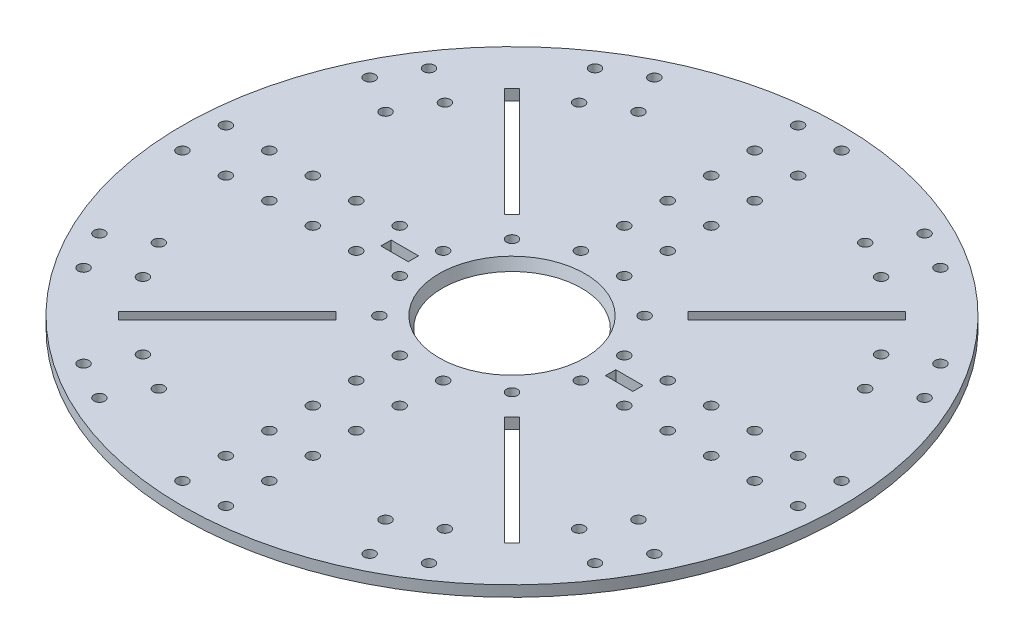
from build123d import *

# Parameters (mm, degrees)
BOSS_EXTRUDE2_DEPTH          = 3
CIRPATTERN2_COUNT            = 4
CUT_EXTRUDE3_DEPTH           = 6
CIRPATTERN4_COUNT            = 4
CUT_EXTRUDE4_START           = -33.9
SKETCH7_W                    = 6
SKETCH7_H                    = 6
CUT_EXTRUDE4_DEPTH           = 33.9
SKETCH8_R                    = 3.175
CUT_EXTRUDE5_DEPTH           = 276.405074148
CUT_EXTRUDE6_REACH           = 278.346
SKETCH11_R                   = 3.2
LPATTERN2_COUNT              = 2
LPATTERN2_PITCH              = 25.4
LPATTERN2_COUNT_DIR2         = 6
LPATTERN2_PITCH_DIR2         = 25.4
CIRPATTERN5_COUNT            = 4
CIRPATTERN5_COPY_1_REACH     = 278.346
CIRPATTERN5_COPY_1_SKETCH_R  = 3.2
CIRPATTERN5_COPY_2_REACH     = 278.346
CIRPATTERN5_COPY_2_SKETCH_R  = 3.2
CIRPATTERN5_COPY_3_REACH     = 278.346
CIRPATTERN5_COPY_3_SKETCH_R  = 3.2
CIRPATTERN5_COPY_4_REACH     = 278.346
CIRPATTERN5_COPY_4_SKETCH_R  = 3.2
CIRPATTERN5_COPY_5_REACH     = 278.346
CIRPATTERN5_COPY_5_SKETCH_R  = 3.2
CIRPATTERN5_COPY_6_REACH     = 278.346
CIRPATTERN5_COPY_6_SKETCH_R  = 3.2
CIRPATTERN5_COPY_7_REACH     = 278.346
CIRPATTERN5_COPY_7_SKETCH_R  = 3.2
CIRPATTERN5_COPY_8_REACH     = 278.346
CIRPATTERN5_COPY_8_SKETCH_R  = 3.2
CIRPATTERN5_COPY_9_REACH     = 278.346
CIRPATTERN5_COPY_9_SKETCH_R  = 3.2
CIRPATTERN5_COPY_10_REACH    = 278.346
CIRPATTERN5_COPY_10_SKETCH_R = 3.2
CIRPATTERN5_COPY_11_REACH    = 278.346
CIRPATTERN5_COPY_11_SKETCH_R = 3.2
CIRPATTERN5_COPY_12_REACH    = 278.346
CIRPATTERN5_COPY_12_SKETCH_R = 3.2
CIRPATTERN5_COPY_13_REACH    = 278.346
CIRPATTERN5_COPY_13_SKETCH_R = 3.2
CIRPATTERN5_COPY_14_REACH    = 278.346
CIRPATTERN5_COPY_14_SKETCH_R = 3.2
CIRPATTERN5_COPY_15_REACH    = 278.346
CIRPATTERN5_COPY_15_SKETCH_R = 3.2
CIRPATTERN5_COPY_16_REACH    = 278.346
CIRPATTERN5_COPY_16_SKETCH_R = 3.2
CIRPATTERN5_COPY_17_REACH    = 278.346
CIRPATTERN5_COPY_17_SKETCH_R = 3.2
CIRPATTERN5_COPY_18_REACH    = 278.346
CIRPATTERN5_COPY_18_SKETCH_R = 3.2
CIRPATTERN5_COPY_19_REACH    = 278.346
CIRPATTERN5_COPY_19_SKETCH_R = 3.2
CIRPATTERN5_COPY_20_REACH    = 278.346
CIRPATTERN5_COPY_20_SKETCH_R = 3.2
CIRPATTERN5_COPY_21_REACH    = 278.346
CIRPATTERN5_COPY_21_SKETCH_R = 3.2
CIRPATTERN5_COPY_22_REACH    = 278.346
CIRPATTERN5_COPY_22_SKETCH_R = 3.2
CIRPATTERN5_COPY_23_REACH    = 278.346
CIRPATTERN5_COPY_23_SKETCH_R = 3.2
CIRPATTERN5_COPY_24_REACH    = 278.346
CIRPATTERN5_COPY_24_SKETCH_R = 3.2
CIRPATTERN5_COPY_25_REACH    = 278.346
CIRPATTERN5_COPY_25_SKETCH_R = 3.2
CIRPATTERN5_COPY_26_REACH    = 278.346
CIRPATTERN5_COPY_26_SKETCH_R = 3.2
CIRPATTERN5_COPY_27_REACH    = 278.346
CIRPATTERN5_COPY_27_SKETCH_R = 3.2
CIRPATTERN5_COPY_28_REACH    = 278.346
CIRPATTERN5_COPY_28_SKETCH_R = 3.2
CIRPATTERN5_COPY_29_REACH    = 278.346
CIRPATTERN5_COPY_29_SKETCH_R = 3.2
CIRPATTERN5_COPY_30_REACH    = 278.346
CIRPATTERN5_COPY_30_SKETCH_R = 3.2
CIRPATTERN5_COPY_31_REACH    = 278.346
CIRPATTERN5_COPY_31_SKETCH_R = 3.2
CIRPATTERN5_COPY_32_REACH    = 278.346
CIRPATTERN5_COPY_32_SKETCH_R = 3.2
CIRPATTERN5_COPY_33_REACH    = 278.346
CIRPATTERN5_COPY_33_SKETCH_R = 3.2
SKETCH17_R                   = 3.2
CUT_EXTRUDE7_DEPTH           = 277.345716208
LPATTERN3_COUNT              = 2
LPATTERN3_PITCH              = 25.4
LPATTERN3_COUNT_DIR2         = 2
LPATTERN3_PITCH_DIR2         = 25.4
MIRROR1_COPY_1_SKETCH_R      = 3.2
MIRROR1_COPY_1_DEPTH         = 277.345716208
MIRROR1_COPY_2_SKETCH_R      = 3.2
MIRROR1_COPY_2_DEPTH         = 277.345716208
MIRROR1_COPY_3_SKETCH_R      = 3.2
MIRROR1_COPY_3_DEPTH         = 277.345716208
MIRROR2_COPY_1_SKETCH_R      = 3.2
MIRROR2_COPY_1_DEPTH         = 277.345716208
MIRROR2_COPY_2_SKETCH_R      = 3.2
MIRROR2_COPY_2_DEPTH         = 277.345716208
MIRROR2_COPY_3_SKETCH_R      = 3.2
MIRROR2_COPY_3_DEPTH         = 277.345716208
MIRROR2_COPY_4_SKETCH_R      = 3.2
MIRROR2_COPY_4_DEPTH         = 277.345716208
MIRROR2_COPY_5_SKETCH_R      = 3.2
MIRROR2_COPY_5_DEPTH         = 277.345716208
MIRROR2_COPY_6_SKETCH_R      = 3.2
MIRROR2_COPY_6_DEPTH         = 277.345716208
MIRROR2_COPY_7_SKETCH_R      = 3.2
MIRROR2_COPY_7_DEPTH         = 277.345716208
CUT_EXTRUDE8_REACH           = 278.346
CIRPATTERN6_COUNT            = 4
CUT_EXTRUDE13_REACH          = 278.346
SKETCH37_R                   = 3.2
CIRPATTERN11_COUNT           = 4
SKETCH23_R                   = 3.2
CUT_EXTRUDE9_DEPTH           = 5.602869
CIRPATTERN7_COUNT            = 2
CIRPATTERN7_ANGLE            = 30
CIRPATTERN8_COUNT            = 4
CIRPATTERN8_COPY_1_SKETCH_R  = 3.2
CIRPATTERN8_COPY_1_DEPTH     = 5.602869
CIRPATTERN8_COPY_2_SKETCH_R  = 3.2
CIRPATTERN8_COPY_2_DEPTH     = 5.602869
CIRPATTERN8_COPY_3_SKETCH_R  = 3.2
CIRPATTERN8_COPY_3_DEPTH     = 5.602869
SKETCH26_R                   = 3.2
CUT_EXTRUDE10_DEPTH          = 277.345716208
LPATTERN4_COUNT              = 2
LPATTERN4_PITCH              = 25.4
LPATTERN4_COUNT_DIR2         = 2
LPATTERN4_PITCH_DIR2         = 25.4
MIRROR3_COPY_1_SKETCH_R      = 3.2
MIRROR3_COPY_1_DEPTH         = 277.345716208
MIRROR3_COPY_2_SKETCH_R      = 3.2
MIRROR3_COPY_2_DEPTH         = 277.345716208
MIRROR3_COPY_3_SKETCH_R      = 3.2
MIRROR3_COPY_3_DEPTH         = 277.345716208
MIRROR4_COPY_1_SKETCH_R      = 3.2
MIRROR4_COPY_1_DEPTH         = 277.345716208
MIRROR4_COPY_2_SKETCH_R      = 3.2
MIRROR4_COPY_2_DEPTH         = 277.345716208
MIRROR4_COPY_3_SKETCH_R      = 3.2
MIRROR4_COPY_3_DEPTH         = 277.345716208
MIRROR4_COPY_4_SKETCH_R      = 3.2
MIRROR4_COPY_4_DEPTH         = 277.345716208
MIRROR4_COPY_5_SKETCH_R      = 3.2
MIRROR4_COPY_5_DEPTH         = 277.345716208
MIRROR4_COPY_6_SKETCH_R      = 3.2
MIRROR4_COPY_6_DEPTH         = 277.345716208
MIRROR4_COPY_7_SKETCH_R      = 3.2
MIRROR4_COPY_7_DEPTH         = 277.345716208
CUT_EXTRUDE11_REACH          = 278.346
SKETCH27_R                   = 3.2
CIRPATTERN9_COUNT            = 4
CUT_EXTRUDE12_REACH          = 280.445
SKETCH28_W                   = 56
SKETCH28_H                   = 6.4
CIRPATTERN10_COUNT           = 4
SPLIT2_START                 = -46.25
SPLIT2_OUTLINE_R             = 3.175
SPLIT2_OUTLINE_R_2           = 3.2
SPLIT2_DEPTH                 = 39.9
SPLIT2_START_2               = -6.35
SPLIT2_2_OUTLINE_W           = 16
SPLIT2_2_OUTLINE_H           = 6
SPLIT2_2_DEPTH               = 7.35


with BuildPart() as part:
    # Sketch1 → Revolve2 (revolve)
    with BuildSketch(Plane.XY, mode=Mode.PRIVATE) as revolve2_sk:
        Polygon((0, -40.25), (0, -46.25), (55.5, -46.25), (55.5, -40.64713119), (36.16453004, -40.64713119), (46.943459637, -6.35), (192.649801929, -6.35), (192.649801929, 0), (42.649801929, 0), (30, -40.25), align=None)
    revolve(revolve2_sk.sketch.rotate(Axis((0, -40.25, 0), (0, -1, 0)), 90), axis=Axis((0, -40.25, 0), (0, -1, 0)))

    # Sketch36 → Revolve3 (revolve)
    with BuildSketch(Plane.XY, mode=Mode.PRIVATE) as revolve3_sk:
        Polygon((46.943459637, -6.35), (45.057774878, -12.35), (66.943459637, -12.35), (66.943459637, -6.35), align=None)
    revolve(revolve3_sk.sketch.rotate(Axis((0, 0, 0), (0, -1, 0)), 180), axis=Axis((0, 0, 0), (0, -1, 0)))

    # Sketch3 → Boss-Extrude2 (add, symmetric)
    with BuildSketch(Plane.XY):
        Polygon((55.5, -40.64713119), (192.649801929, -6.35), (0, -6.35), (0, -40.64713119), align=None)
    boss_extrude2 = extrude(amount=BOSS_EXTRUDE2_DEPTH, both=True)

    # CirPattern2: Boss-Extrude2 ×4 about axis
    cirpattern2_axis = Axis((0, 0, 0), (0, 1, 0))
    for i in range(1, CIRPATTERN2_COUNT):
        add(boss_extrude2.rotate(cirpattern2_axis, i * 360 / CIRPATTERN2_COUNT))

    # Sketch6 → Cut-Extrude3 (cut)
    with BuildSketch(Plane.XY.offset(3)):
        Polygon((-3, -6.35), (-40.5432779, -6.35), (-29.849623113, -40.25), (-3, -40.25), align=None)
    cut_extrude3 = extrude(amount=-CUT_EXTRUDE3_DEPTH, mode=Mode.SUBTRACT)

    # CirPattern4: Cut-Extrude3 ×4 about axis
    cirpattern4_axis = Axis((0, 0, 0), (0, 1, 0))
    for i in range(1, CIRPATTERN4_COUNT):
        add(cut_extrude3.rotate(cirpattern4_axis, i * 360 / CIRPATTERN4_COUNT), mode=Mode.SUBTRACT)

    # Sketch7 → Cut-Extrude4 (cut)
    with BuildSketch(Plane(origin=(0, -6.35, 0), x_dir=(1, 0, 0), z_dir=(0, 1, 0)).offset(CUT_EXTRUDE4_START)):
        Rectangle(SKETCH7_W, SKETCH7_H)
    extrude(amount=CUT_EXTRUDE4_DEPTH, mode=Mode.SUBTRACT)

    # Sketch8 → Cut-Extrude5 (cut, through all)
    with BuildSketch(Plane(origin=(0, -40.25, 0), x_dir=(1, 0, 0), z_dir=(0, 1, 0))):
        with Locations(Location((0, 0, 0), (0, 0, 180))):
            Circle(SKETCH8_R)
    extrude(amount=-CUT_EXTRUDE5_DEPTH, mode=Mode.SUBTRACT)

    # Sketch11 → Cut-Extrude6 (cut, up to next)
    with BuildSketch(Plane.XZ, mode=Mode.PRIVATE) as cut_extrude6_sk1:
        with Locations(Location((-12.7, 179.949801929, 0), (0, 0, 90))):
            Circle(SKETCH11_R)
    cut_extrude6_tool1 = extrude(cut_extrude6_sk1.sketch, amount=CUT_EXTRUDE6_REACH, mode=Mode.PRIVATE) & part.part
    cut_extrude6 = cut_extrude6_tool1.solids().sort_by_distance((-12.7, 0, 179.949802))[0]
    add(cut_extrude6, mode=Mode.SUBTRACT)

    # LPattern2: Cut-Extrude6; each copy of Cut-Extrude6 runs up to whatever stops it at its own place
    lpattern2_before = part.part  # the part as the pattern finds it: every copy runs up to it
    lpattern2_cut_extrude6_long = extrude(cut_extrude6_sk1.sketch, amount=CUT_EXTRUDE6_REACH, mode=Mode.PRIVATE)
    lpattern2_cut_extrude6_tool1 = lpattern2_cut_extrude6_long.moved(Location(Vector(1, 0, 0) * (0 * LPATTERN2_PITCH) + Vector(0, 0, -1) * (1 * LPATTERN2_PITCH_DIR2))) & lpattern2_before
    add(lpattern2_cut_extrude6_tool1.solids().sort_by_distance((-12.7, 0, 154.549802))[0], mode=Mode.SUBTRACT)
    lpattern2_cut_extrude6_tool2 = lpattern2_cut_extrude6_long.moved(Location(Vector(1, 0, 0) * (0 * LPATTERN2_PITCH) + Vector(0, 0, -1) * (2 * LPATTERN2_PITCH_DIR2))) & lpattern2_before
    add(lpattern2_cut_extrude6_tool2.solids().sort_by_distance((-12.7, 0, 129.149802))[0], mode=Mode.SUBTRACT)
    lpattern2_cut_extrude6_tool3 = lpattern2_cut_extrude6_long.moved(Location(Vector(1, 0, 0) * (0 * LPATTERN2_PITCH) + Vector(0, 0, -1) * (3 * LPATTERN2_PITCH_DIR2))) & lpattern2_before
    add(lpattern2_cut_extrude6_tool3.solids().sort_by_distance((-12.7, 0, 103.749802))[0], mode=Mode.SUBTRACT)
    lpattern2_cut_extrude6_tool4 = lpattern2_cut_extrude6_long.moved(Location(Vector(1, 0, 0) * (0 * LPATTERN2_PITCH) + Vector(0, 0, -1) * (4 * LPATTERN2_PITCH_DIR2))) & lpattern2_before
    add(lpattern2_cut_extrude6_tool4.solids().sort_by_distance((-12.7, 0, 78.349802))[0], mode=Mode.SUBTRACT)
    lpattern2_cut_extrude6_tool5 = lpattern2_cut_extrude6_long.moved(Location(Vector(1, 0, 0) * (0 * LPATTERN2_PITCH) + Vector(0, 0, -1) * (5 * LPATTERN2_PITCH_DIR2))) & lpattern2_before
    add(lpattern2_cut_extrude6_tool5.solids().sort_by_distance((-12.7, 0, 52.949802))[0], mode=Mode.SUBTRACT)
    lpattern2_cut_extrude6_tool6 = lpattern2_cut_extrude6_long.moved(Location(Vector(1, 0, 0) * (1 * LPATTERN2_PITCH) + Vector(0, 0, -1) * (0 * LPATTERN2_PITCH_DIR2))) & lpattern2_before
    add(lpattern2_cut_extrude6_tool6.solids().sort_by_distance((12.7, 0, 179.949802))[0], mode=Mode.SUBTRACT)
    lpattern2_cut_extrude6_tool7 = lpattern2_cut_extrude6_long.moved(Location(Vector(1, 0, 0) * (1 * LPATTERN2_PITCH) + Vector(0, 0, -1) * (1 * LPATTERN2_PITCH_DIR2))) & lpattern2_before
    add(lpattern2_cut_extrude6_tool7.solids().sort_by_distance((12.7, 0, 154.549802))[0], mode=Mode.SUBTRACT)
    lpattern2_cut_extrude6_tool8 = lpattern2_cut_extrude6_long.moved(Location(Vector(1, 0, 0) * (1 * LPATTERN2_PITCH) + Vector(0, 0, -1) * (2 * LPATTERN2_PITCH_DIR2))) & lpattern2_before
    add(lpattern2_cut_extrude6_tool8.solids().sort_by_distance((12.7, 0, 129.149802))[0], mode=Mode.SUBTRACT)
    lpattern2_cut_extrude6_tool9 = lpattern2_cut_extrude6_long.moved(Location(Vector(1, 0, 0) * (1 * LPATTERN2_PITCH) + Vector(0, 0, -1) * (3 * LPATTERN2_PITCH_DIR2))) & lpattern2_before
    add(lpattern2_cut_extrude6_tool9.solids().sort_by_distance((12.7, 0, 103.749802))[0], mode=Mode.SUBTRACT)
    lpattern2_cut_extrude6_tool10 = lpattern2_cut_extrude6_long.moved(Location(Vector(1, 0, 0) * (1 * LPATTERN2_PITCH) + Vector(0, 0, -1) * (4 * LPATTERN2_PITCH_DIR2))) & lpattern2_before
    add(lpattern2_cut_extrude6_tool10.solids().sort_by_distance((12.7, 0, 78.349802))[0], mode=Mode.SUBTRACT)
    lpattern2_cut_extrude6_tool11 = lpattern2_cut_extrude6_long.moved(Location(Vector(1, 0, 0) * (1 * LPATTERN2_PITCH) + Vector(0, 0, -1) * (5 * LPATTERN2_PITCH_DIR2))) & lpattern2_before
    add(lpattern2_cut_extrude6_tool11.solids().sort_by_distance((12.7, 0, 52.949802))[0], mode=Mode.SUBTRACT)

    # CirPattern5: Cut-Extrude6 ×4 about axis
    cirpattern5_axis = Axis((0, 0, 0), (0, 1, 0))
    for i in range(1, CIRPATTERN5_COUNT):
        add(cut_extrude6.rotate(cirpattern5_axis, i * 360 / CIRPATTERN5_COUNT), mode=Mode.SUBTRACT)

    # CirPattern5 copy 1 sketch → CirPattern5 copy 1 (cut, up to next)
    with BuildSketch(Plane(origin=(-25.4, 0, 0), x_dir=(0, 0, -1), z_dir=(0, -1, 0)), mode=Mode.PRIVATE) as cirpattern5_copy_1_sk1:
        with Locations(Location((-12.7, 179.949801929, 0), (0, 0, 90))):
            Circle(CIRPATTERN5_COPY_1_SKETCH_R)
    cirpattern5_copy_1_tool1 = extrude(cirpattern5_copy_1_sk1.sketch, amount=CIRPATTERN5_COPY_1_REACH, mode=Mode.PRIVATE) & part.part
    add(cirpattern5_copy_1_tool1.solids().sort_by_distance((154.549802, 0, 12.7))[0], mode=Mode.SUBTRACT)

    # CirPattern5 copy 2 sketch → CirPattern5 copy 2 (cut, up to next)
    with BuildSketch(Plane(origin=(0, 0, 25.4), x_dir=(-1, 0, 0), z_dir=(0, -1, 0)), mode=Mode.PRIVATE) as cirpattern5_copy_2_sk1:
        with Locations(Location((-12.7, 179.949801929, 0), (0, 0, 90))):
            Circle(CIRPATTERN5_COPY_2_SKETCH_R)
    cirpattern5_copy_2_tool1 = extrude(cirpattern5_copy_2_sk1.sketch, amount=CIRPATTERN5_COPY_2_REACH, mode=Mode.PRIVATE) & part.part
    add(cirpattern5_copy_2_tool1.solids().sort_by_distance((12.7, 0, -154.549802))[0], mode=Mode.SUBTRACT)

    # CirPattern5 copy 3 sketch → CirPattern5 copy 3 (cut, up to next)
    with BuildSketch(Plane(origin=(25.4, 0, 0), x_dir=(0, 0, 1), z_dir=(0, -1, 0)), mode=Mode.PRIVATE) as cirpattern5_copy_3_sk1:
        with Locations(Location((-12.7, 179.949801929, 0), (0, 0, 90))):
            Circle(CIRPATTERN5_COPY_3_SKETCH_R)
    cirpattern5_copy_3_tool1 = extrude(cirpattern5_copy_3_sk1.sketch, amount=CIRPATTERN5_COPY_3_REACH, mode=Mode.PRIVATE) & part.part
    add(cirpattern5_copy_3_tool1.solids().sort_by_distance((-154.549802, 0, -12.7))[0], mode=Mode.SUBTRACT)

    # CirPattern5 copy 4 sketch → CirPattern5 copy 4 (cut, up to next)
    with BuildSketch(Plane(origin=(-50.8, 0, 0), x_dir=(0, 0, -1), z_dir=(0, -1, 0)), mode=Mode.PRIVATE) as cirpattern5_copy_4_sk1:
        with Locations(Location((-12.7, 179.949801929, 0), (0, 0, 90))):
            Circle(CIRPATTERN5_COPY_4_SKETCH_R)
    cirpattern5_copy_4_tool1 = extrude(cirpattern5_copy_4_sk1.sketch, amount=CIRPATTERN5_COPY_4_REACH, mode=Mode.PRIVATE) & part.part
    add(cirpattern5_copy_4_tool1.solids().sort_by_distance((129.149802, 0, 12.7))[0], mode=Mode.SUBTRACT)

    # CirPattern5 copy 5 sketch → CirPattern5 copy 5 (cut, up to next)
    with BuildSketch(Plane(origin=(0, 0, 50.8), x_dir=(-1, 0, 0), z_dir=(0, -1, 0)), mode=Mode.PRIVATE) as cirpattern5_copy_5_sk1:
        with Locations(Location((-12.7, 179.949801929, 0), (0, 0, 90))):
            Circle(CIRPATTERN5_COPY_5_SKETCH_R)
    cirpattern5_copy_5_tool1 = extrude(cirpattern5_copy_5_sk1.sketch, amount=CIRPATTERN5_COPY_5_REACH, mode=Mode.PRIVATE) & part.part
    add(cirpattern5_copy_5_tool1.solids().sort_by_distance((12.7, 0, -129.149802))[0], mode=Mode.SUBTRACT)

    # CirPattern5 copy 6 sketch → CirPattern5 copy 6 (cut, up to next)
    with BuildSketch(Plane(origin=(50.8, 0, 0), x_dir=(0, 0, 1), z_dir=(0, -1, 0)), mode=Mode.PRIVATE) as cirpattern5_copy_6_sk1:
        with Locations(Location((-12.7, 179.949801929, 0), (0, 0, 90))):
            Circle(CIRPATTERN5_COPY_6_SKETCH_R)
    cirpattern5_copy_6_tool1 = extrude(cirpattern5_copy_6_sk1.sketch, amount=CIRPATTERN5_COPY_6_REACH, mode=Mode.PRIVATE) & part.part
    add(cirpattern5_copy_6_tool1.solids().sort_by_distance((-129.149802, 0, -12.7))[0], mode=Mode.SUBTRACT)

    # CirPattern5 copy 7 sketch → CirPattern5 copy 7 (cut, up to next)
    with BuildSketch(Plane(origin=(-76.2, 0, 0), x_dir=(0, 0, -1), z_dir=(0, -1, 0)), mode=Mode.PRIVATE) as cirpattern5_copy_7_sk1:
        with Locations(Location((-12.7, 179.949801929, 0), (0, 0, 90))):
            Circle(CIRPATTERN5_COPY_7_SKETCH_R)
    cirpattern5_copy_7_tool1 = extrude(cirpattern5_copy_7_sk1.sketch, amount=CIRPATTERN5_COPY_7_REACH, mode=Mode.PRIVATE) & part.part
    add(cirpattern5_copy_7_tool1.solids().sort_by_distance((103.749802, 0, 12.7))[0], mode=Mode.SUBTRACT)

    # CirPattern5 copy 8 sketch → CirPattern5 copy 8 (cut, up to next)
    with BuildSketch(Plane(origin=(0, 0, 76.2), x_dir=(-1, 0, 0), z_dir=(0, -1, 0)), mode=Mode.PRIVATE) as cirpattern5_copy_8_sk1:
        with Locations(Location((-12.7, 179.949801929, 0), (0, 0, 90))):
            Circle(CIRPATTERN5_COPY_8_SKETCH_R)
    cirpattern5_copy_8_tool1 = extrude(cirpattern5_copy_8_sk1.sketch, amount=CIRPATTERN5_COPY_8_REACH, mode=Mode.PRIVATE) & part.part
    add(cirpattern5_copy_8_tool1.solids().sort_by_distance((12.7, 0, -103.749802))[0], mode=Mode.SUBTRACT)

    # CirPattern5 copy 9 sketch → CirPattern5 copy 9 (cut, up to next)
    with BuildSketch(Plane(origin=(76.2, 0, 0), x_dir=(0, 0, 1), z_dir=(0, -1, 0)), mode=Mode.PRIVATE) as cirpattern5_copy_9_sk1:
        with Locations(Location((-12.7, 179.949801929, 0), (0, 0, 90))):
            Circle(CIRPATTERN5_COPY_9_SKETCH_R)
    cirpattern5_copy_9_tool1 = extrude(cirpattern5_copy_9_sk1.sketch, amount=CIRPATTERN5_COPY_9_REACH, mode=Mode.PRIVATE) & part.part
    add(cirpattern5_copy_9_tool1.solids().sort_by_distance((-103.749802, 0, -12.7))[0], mode=Mode.SUBTRACT)

    # CirPattern5 copy 10 sketch → CirPattern5 copy 10 (cut, up to next)
    with BuildSketch(Plane(origin=(-101.6, 0, 0), x_dir=(0, 0, -1), z_dir=(0, -1, 0)), mode=Mode.PRIVATE) as cirpattern5_copy_10_sk1:
        with Locations(Location((-12.7, 179.949801929, 0), (0, 0, 90))):
            Circle(CIRPATTERN5_COPY_10_SKETCH_R)
    cirpattern5_copy_10_tool1 = extrude(cirpattern5_copy_10_sk1.sketch, amount=CIRPATTERN5_COPY_10_REACH, mode=Mode.PRIVATE) & part.part
    add(cirpattern5_copy_10_tool1.solids().sort_by_distance((78.349802, 0, 12.7))[0], mode=Mode.SUBTRACT)

    # CirPattern5 copy 11 sketch → CirPattern5 copy 11 (cut, up to next)
    with BuildSketch(Plane(origin=(0, 0, 101.6), x_dir=(-1, 0, 0), z_dir=(0, -1, 0)), mode=Mode.PRIVATE) as cirpattern5_copy_11_sk1:
        with Locations(Location((-12.7, 179.949801929, 0), (0, 0, 90))):
            Circle(CIRPATTERN5_COPY_11_SKETCH_R)
    cirpattern5_copy_11_tool1 = extrude(cirpattern5_copy_11_sk1.sketch, amount=CIRPATTERN5_COPY_11_REACH, mode=Mode.PRIVATE) & part.part
    add(cirpattern5_copy_11_tool1.solids().sort_by_distance((12.7, 0, -78.349802))[0], mode=Mode.SUBTRACT)

    # CirPattern5 copy 12 sketch → CirPattern5 copy 12 (cut, up to next)
    with BuildSketch(Plane(origin=(101.6, 0, 0), x_dir=(0, 0, 1), z_dir=(0, -1, 0)), mode=Mode.PRIVATE) as cirpattern5_copy_12_sk1:
        with Locations(Location((-12.7, 179.949801929, 0), (0, 0, 90))):
            Circle(CIRPATTERN5_COPY_12_SKETCH_R)
    cirpattern5_copy_12_tool1 = extrude(cirpattern5_copy_12_sk1.sketch, amount=CIRPATTERN5_COPY_12_REACH, mode=Mode.PRIVATE) & part.part
    add(cirpattern5_copy_12_tool1.solids().sort_by_distance((-78.349802, 0, -12.7))[0], mode=Mode.SUBTRACT)

    # CirPattern5 copy 13 sketch → CirPattern5 copy 13 (cut, up to next)
    with BuildSketch(Plane(origin=(-127, 0, 0), x_dir=(0, 0, -1), z_dir=(0, -1, 0)), mode=Mode.PRIVATE) as cirpattern5_copy_13_sk1:
        with Locations(Location((-12.7, 179.949801929, 0), (0, 0, 90))):
            Circle(CIRPATTERN5_COPY_13_SKETCH_R)
    cirpattern5_copy_13_tool1 = extrude(cirpattern5_copy_13_sk1.sketch, amount=CIRPATTERN5_COPY_13_REACH, mode=Mode.PRIVATE) & part.part
    add(cirpattern5_copy_13_tool1.solids().sort_by_distance((52.949802, 0, 12.7))[0], mode=Mode.SUBTRACT)

    # CirPattern5 copy 14 sketch → CirPattern5 copy 14 (cut, up to next)
    with BuildSketch(Plane(origin=(0, 0, 127), x_dir=(-1, 0, 0), z_dir=(0, -1, 0)), mode=Mode.PRIVATE) as cirpattern5_copy_14_sk1:
        with Locations(Location((-12.7, 179.949801929, 0), (0, 0, 90))):
            Circle(CIRPATTERN5_COPY_14_SKETCH_R)
    cirpattern5_copy_14_tool1 = extrude(cirpattern5_copy_14_sk1.sketch, amount=CIRPATTERN5_COPY_14_REACH, mode=Mode.PRIVATE) & part.part
    add(cirpattern5_copy_14_tool1.solids().sort_by_distance((12.7, 0, -52.949802))[0], mode=Mode.SUBTRACT)

    # CirPattern5 copy 15 sketch → CirPattern5 copy 15 (cut, up to next)
    with BuildSketch(Plane(origin=(127, 0, 0), x_dir=(0, 0, 1), z_dir=(0, -1, 0)), mode=Mode.PRIVATE) as cirpattern5_copy_15_sk1:
        with Locations(Location((-12.7, 179.949801929, 0), (0, 0, 90))):
            Circle(CIRPATTERN5_COPY_15_SKETCH_R)
    cirpattern5_copy_15_tool1 = extrude(cirpattern5_copy_15_sk1.sketch, amount=CIRPATTERN5_COPY_15_REACH, mode=Mode.PRIVATE) & part.part
    add(cirpattern5_copy_15_tool1.solids().sort_by_distance((-52.949802, 0, -12.7))[0], mode=Mode.SUBTRACT)

    # CirPattern5 copy 16 sketch → CirPattern5 copy 16 (cut, up to next)
    with BuildSketch(Plane(origin=(0, 0, -25.4), x_dir=(0, 0, -1), z_dir=(0, -1, 0)), mode=Mode.PRIVATE) as cirpattern5_copy_16_sk1:
        with Locations(Location((-12.7, 179.949801929, 0), (0, 0, 90))):
            Circle(CIRPATTERN5_COPY_16_SKETCH_R)
    cirpattern5_copy_16_tool1 = extrude(cirpattern5_copy_16_sk1.sketch, amount=CIRPATTERN5_COPY_16_REACH, mode=Mode.PRIVATE) & part.part
    add(cirpattern5_copy_16_tool1.solids().sort_by_distance((179.949802, 0, -12.7))[0], mode=Mode.SUBTRACT)

    # CirPattern5 copy 17 sketch → CirPattern5 copy 17 (cut, up to next)
    with BuildSketch(Plane(origin=(-25.4, 0, 0), x_dir=(-1, 0, 0), z_dir=(0, -1, 0)), mode=Mode.PRIVATE) as cirpattern5_copy_17_sk1:
        with Locations(Location((-12.7, 179.949801929, 0), (0, 0, 90))):
            Circle(CIRPATTERN5_COPY_17_SKETCH_R)
    cirpattern5_copy_17_tool1 = extrude(cirpattern5_copy_17_sk1.sketch, amount=CIRPATTERN5_COPY_17_REACH, mode=Mode.PRIVATE) & part.part
    add(cirpattern5_copy_17_tool1.solids().sort_by_distance((-12.7, 0, -179.949802))[0], mode=Mode.SUBTRACT)

    # CirPattern5 copy 18 sketch → CirPattern5 copy 18 (cut, up to next)
    with BuildSketch(Plane(origin=(0, 0, 25.4), x_dir=(0, 0, 1), z_dir=(0, -1, 0)), mode=Mode.PRIVATE) as cirpattern5_copy_18_sk1:
        with Locations(Location((-12.7, 179.949801929, 0), (0, 0, 90))):
            Circle(CIRPATTERN5_COPY_18_SKETCH_R)
    cirpattern5_copy_18_tool1 = extrude(cirpattern5_copy_18_sk1.sketch, amount=CIRPATTERN5_COPY_18_REACH, mode=Mode.PRIVATE) & part.part
    add(cirpattern5_copy_18_tool1.solids().sort_by_distance((-179.949802, 0, 12.7))[0], mode=Mode.SUBTRACT)

    # CirPattern5 copy 19 sketch → CirPattern5 copy 19 (cut, up to next)
    with BuildSketch(Plane(origin=(-25.4, 0, -25.4), x_dir=(0, 0, -1), z_dir=(0, -1, 0)), mode=Mode.PRIVATE) as cirpattern5_copy_19_sk1:
        with Locations(Location((-12.7, 179.949801929, 0), (0, 0, 90))):
            Circle(CIRPATTERN5_COPY_19_SKETCH_R)
    cirpattern5_copy_19_tool1 = extrude(cirpattern5_copy_19_sk1.sketch, amount=CIRPATTERN5_COPY_19_REACH, mode=Mode.PRIVATE) & part.part
    add(cirpattern5_copy_19_tool1.solids().sort_by_distance((154.549802, 0, -12.7))[0], mode=Mode.SUBTRACT)

    # CirPattern5 copy 20 sketch → CirPattern5 copy 20 (cut, up to next)
    with BuildSketch(Plane(origin=(-25.4, 0, 25.4), x_dir=(-1, 0, 0), z_dir=(0, -1, 0)), mode=Mode.PRIVATE) as cirpattern5_copy_20_sk1:
        with Locations(Location((-12.7, 179.949801929, 0), (0, 0, 90))):
            Circle(CIRPATTERN5_COPY_20_SKETCH_R)
    cirpattern5_copy_20_tool1 = extrude(cirpattern5_copy_20_sk1.sketch, amount=CIRPATTERN5_COPY_20_REACH, mode=Mode.PRIVATE) & part.part
    add(cirpattern5_copy_20_tool1.solids().sort_by_distance((-12.7, 0, -154.549802))[0], mode=Mode.SUBTRACT)

    # CirPattern5 copy 21 sketch → CirPattern5 copy 21 (cut, up to next)
    with BuildSketch(Plane(origin=(25.4, 0, 25.4), x_dir=(0, 0, 1), z_dir=(0, -1, 0)), mode=Mode.PRIVATE) as cirpattern5_copy_21_sk1:
        with Locations(Location((-12.7, 179.949801929, 0), (0, 0, 90))):
            Circle(CIRPATTERN5_COPY_21_SKETCH_R)
    cirpattern5_copy_21_tool1 = extrude(cirpattern5_copy_21_sk1.sketch, amount=CIRPATTERN5_COPY_21_REACH, mode=Mode.PRIVATE) & part.part
    add(cirpattern5_copy_21_tool1.solids().sort_by_distance((-154.549802, 0, 12.7))[0], mode=Mode.SUBTRACT)

    # CirPattern5 copy 22 sketch → CirPattern5 copy 22 (cut, up to next)
    with BuildSketch(Plane(origin=(-50.8, 0, -25.4), x_dir=(0, 0, -1), z_dir=(0, -1, 0)), mode=Mode.PRIVATE) as cirpattern5_copy_22_sk1:
        with Locations(Location((-12.7, 179.949801929, 0), (0, 0, 90))):
            Circle(CIRPATTERN5_COPY_22_SKETCH_R)
    cirpattern5_copy_22_tool1 = extrude(cirpattern5_copy_22_sk1.sketch, amount=CIRPATTERN5_COPY_22_REACH, mode=Mode.PRIVATE) & part.part
    add(cirpattern5_copy_22_tool1.solids().sort_by_distance((129.149802, 0, -12.7))[0], mode=Mode.SUBTRACT)

    # CirPattern5 copy 23 sketch → CirPattern5 copy 23 (cut, up to next)
    with BuildSketch(Plane(origin=(-25.4, 0, 50.8), x_dir=(-1, 0, 0), z_dir=(0, -1, 0)), mode=Mode.PRIVATE) as cirpattern5_copy_23_sk1:
        with Locations(Location((-12.7, 179.949801929, 0), (0, 0, 90))):
            Circle(CIRPATTERN5_COPY_23_SKETCH_R)
    cirpattern5_copy_23_tool1 = extrude(cirpattern5_copy_23_sk1.sketch, amount=CIRPATTERN5_COPY_23_REACH, mode=Mode.PRIVATE) & part.part
    add(cirpattern5_copy_23_tool1.solids().sort_by_distance((-12.7, 0, -129.149802))[0], mode=Mode.SUBTRACT)

    # CirPattern5 copy 24 sketch → CirPattern5 copy 24 (cut, up to next)
    with BuildSketch(Plane(origin=(50.8, 0, 25.4), x_dir=(0, 0, 1), z_dir=(0, -1, 0)), mode=Mode.PRIVATE) as cirpattern5_copy_24_sk1:
        with Locations(Location((-12.7, 179.949801929, 0), (0, 0, 90))):
            Circle(CIRPATTERN5_COPY_24_SKETCH_R)
    cirpattern5_copy_24_tool1 = extrude(cirpattern5_copy_24_sk1.sketch, amount=CIRPATTERN5_COPY_24_REACH, mode=Mode.PRIVATE) & part.part
    add(cirpattern5_copy_24_tool1.solids().sort_by_distance((-129.149802, 0, 12.7))[0], mode=Mode.SUBTRACT)

    # CirPattern5 copy 25 sketch → CirPattern5 copy 25 (cut, up to next)
    with BuildSketch(Plane(origin=(-76.2, 0, -25.4), x_dir=(0, 0, -1), z_dir=(0, -1, 0)), mode=Mode.PRIVATE) as cirpattern5_copy_25_sk1:
        with Locations(Location((-12.7, 179.949801929, 0), (0, 0, 90))):
            Circle(CIRPATTERN5_COPY_25_SKETCH_R)
    cirpattern5_copy_25_tool1 = extrude(cirpattern5_copy_25_sk1.sketch, amount=CIRPATTERN5_COPY_25_REACH, mode=Mode.PRIVATE) & part.part
    add(cirpattern5_copy_25_tool1.solids().sort_by_distance((103.749802, 0, -12.7))[0], mode=Mode.SUBTRACT)

    # CirPattern5 copy 26 sketch → CirPattern5 copy 26 (cut, up to next)
    with BuildSketch(Plane(origin=(-25.4, 0, 76.2), x_dir=(-1, 0, 0), z_dir=(0, -1, 0)), mode=Mode.PRIVATE) as cirpattern5_copy_26_sk1:
        with Locations(Location((-12.7, 179.949801929, 0), (0, 0, 90))):
            Circle(CIRPATTERN5_COPY_26_SKETCH_R)
    cirpattern5_copy_26_tool1 = extrude(cirpattern5_copy_26_sk1.sketch, amount=CIRPATTERN5_COPY_26_REACH, mode=Mode.PRIVATE) & part.part
    add(cirpattern5_copy_26_tool1.solids().sort_by_distance((-12.7, 0, -103.749802))[0], mode=Mode.SUBTRACT)

    # CirPattern5 copy 27 sketch → CirPattern5 copy 27 (cut, up to next)
    with BuildSketch(Plane(origin=(76.2, 0, 25.4), x_dir=(0, 0, 1), z_dir=(0, -1, 0)), mode=Mode.PRIVATE) as cirpattern5_copy_27_sk1:
        with Locations(Location((-12.7, 179.949801929, 0), (0, 0, 90))):
            Circle(CIRPATTERN5_COPY_27_SKETCH_R)
    cirpattern5_copy_27_tool1 = extrude(cirpattern5_copy_27_sk1.sketch, amount=CIRPATTERN5_COPY_27_REACH, mode=Mode.PRIVATE) & part.part
    add(cirpattern5_copy_27_tool1.solids().sort_by_distance((-103.749802, 0, 12.7))[0], mode=Mode.SUBTRACT)

    # CirPattern5 copy 28 sketch → CirPattern5 copy 28 (cut, up to next)
    with BuildSketch(Plane(origin=(-101.6, 0, -25.4), x_dir=(0, 0, -1), z_dir=(0, -1, 0)), mode=Mode.PRIVATE) as cirpattern5_copy_28_sk1:
        with Locations(Location((-12.7, 179.949801929, 0), (0, 0, 90))):
            Circle(CIRPATTERN5_COPY_28_SKETCH_R)
    cirpattern5_copy_28_tool1 = extrude(cirpattern5_copy_28_sk1.sketch, amount=CIRPATTERN5_COPY_28_REACH, mode=Mode.PRIVATE) & part.part
    add(cirpattern5_copy_28_tool1.solids().sort_by_distance((78.349802, 0, -12.7))[0], mode=Mode.SUBTRACT)

    # CirPattern5 copy 29 sketch → CirPattern5 copy 29 (cut, up to next)
    with BuildSketch(Plane(origin=(-25.4, 0, 101.6), x_dir=(-1, 0, 0), z_dir=(0, -1, 0)), mode=Mode.PRIVATE) as cirpattern5_copy_29_sk1:
        with Locations(Location((-12.7, 179.949801929, 0), (0, 0, 90))):
            Circle(CIRPATTERN5_COPY_29_SKETCH_R)
    cirpattern5_copy_29_tool1 = extrude(cirpattern5_copy_29_sk1.sketch, amount=CIRPATTERN5_COPY_29_REACH, mode=Mode.PRIVATE) & part.part
    add(cirpattern5_copy_29_tool1.solids().sort_by_distance((-12.7, 0, -78.349802))[0], mode=Mode.SUBTRACT)

    # CirPattern5 copy 30 sketch → CirPattern5 copy 30 (cut, up to next)
    with BuildSketch(Plane(origin=(101.6, 0, 25.4), x_dir=(0, 0, 1), z_dir=(0, -1, 0)), mode=Mode.PRIVATE) as cirpattern5_copy_30_sk1:
        with Locations(Location((-12.7, 179.949801929, 0), (0, 0, 90))):
            Circle(CIRPATTERN5_COPY_30_SKETCH_R)
    cirpattern5_copy_30_tool1 = extrude(cirpattern5_copy_30_sk1.sketch, amount=CIRPATTERN5_COPY_30_REACH, mode=Mode.PRIVATE) & part.part
    add(cirpattern5_copy_30_tool1.solids().sort_by_distance((-78.349802, 0, 12.7))[0], mode=Mode.SUBTRACT)

    # CirPattern5 copy 31 sketch → CirPattern5 copy 31 (cut, up to next)
    with BuildSketch(Plane(origin=(-127, 0, -25.4), x_dir=(0, 0, -1), z_dir=(0, -1, 0)), mode=Mode.PRIVATE) as cirpattern5_copy_31_sk1:
        with Locations(Location((-12.7, 179.949801929, 0), (0, 0, 90))):
            Circle(CIRPATTERN5_COPY_31_SKETCH_R)
    cirpattern5_copy_31_tool1 = extrude(cirpattern5_copy_31_sk1.sketch, amount=CIRPATTERN5_COPY_31_REACH, mode=Mode.PRIVATE) & part.part
    add(cirpattern5_copy_31_tool1.solids().sort_by_distance((52.949802, 0, -12.7))[0], mode=Mode.SUBTRACT)

    # CirPattern5 copy 32 sketch → CirPattern5 copy 32 (cut, up to next)
    with BuildSketch(Plane(origin=(-25.4, 0, 127), x_dir=(-1, 0, 0), z_dir=(0, -1, 0)), mode=Mode.PRIVATE) as cirpattern5_copy_32_sk1:
        with Locations(Location((-12.7, 179.949801929, 0), (0, 0, 90))):
            Circle(CIRPATTERN5_COPY_32_SKETCH_R)
    cirpattern5_copy_32_tool1 = extrude(cirpattern5_copy_32_sk1.sketch, amount=CIRPATTERN5_COPY_32_REACH, mode=Mode.PRIVATE) & part.part
    add(cirpattern5_copy_32_tool1.solids().sort_by_distance((-12.7, 0, -52.949802))[0], mode=Mode.SUBTRACT)

    # CirPattern5 copy 33 sketch → CirPattern5 copy 33 (cut, up to next)
    with BuildSketch(Plane(origin=(127, 0, 25.4), x_dir=(0, 0, 1), z_dir=(0, -1, 0)), mode=Mode.PRIVATE) as cirpattern5_copy_33_sk1:
        with Locations(Location((-12.7, 179.949801929, 0), (0, 0, 90))):
            Circle(CIRPATTERN5_COPY_33_SKETCH_R)
    cirpattern5_copy_33_tool1 = extrude(cirpattern5_copy_33_sk1.sketch, amount=CIRPATTERN5_COPY_33_REACH, mode=Mode.PRIVATE) & part.part
    add(cirpattern5_copy_33_tool1.solids().sort_by_distance((-52.949802, 0, 12.7))[0], mode=Mode.SUBTRACT)

    # Sketch17 → Cut-Extrude7 (cut, through all)
    with BuildSketch(Plane(origin=(0, 0, 0), x_dir=(1, 0, 0), z_dir=(0, 1, 0))):
        with Locations(Location((149.491099877, -100.973423593, 0), (0, 0, 180))):
            Circle(SKETCH17_R)
    cut_extrude7 = extrude(amount=-CUT_EXTRUDE7_DEPTH, mode=Mode.SUBTRACT)

    # LPattern3: Cut-Extrude7 2 × 2
    with Locations(*[Vector(-0.866025403784438, 0, -0.5000000000000012) * (i * LPATTERN3_PITCH) + Vector(0.500000000000003, 0, -0.866025403784437) * (j * LPATTERN3_PITCH_DIR2) for i in range(LPATTERN3_COUNT) for j in range(LPATTERN3_COUNT_DIR2) if (i, j) != (0, 0)]):
        add(cut_extrude7, mode=Mode.SUBTRACT)

    # Mirror1: Cut-Extrude7 across plane
    add(cut_extrude7.mirror(Plane(origin=(0, 0, 0), x_dir=(0, 0, 1), z_dir=(1, 0, 0))), mode=Mode.SUBTRACT)

    # Mirror1 copy 1 sketch → Mirror1 copy 1 (cut, through all)
    with BuildSketch(Plane(origin=(-12.7, 0, -21.997045256), x_dir=(-1, 0, 0), z_dir=(0, 1, 0))):
        with Locations((149.491099877, 100.973423593)):
            Circle(MIRROR1_COPY_1_SKETCH_R)
    extrude(amount=-MIRROR1_COPY_1_DEPTH, mode=Mode.SUBTRACT)

    # Mirror1 copy 2 sketch → Mirror1 copy 2 (cut, through all)
    with BuildSketch(Plane(origin=(21.997045256, 0, -12.7), x_dir=(-1, 0, 0), z_dir=(0, 1, 0))):
        with Locations((149.491099877, 100.973423593)):
            Circle(MIRROR1_COPY_2_SKETCH_R)
    extrude(amount=-MIRROR1_COPY_2_DEPTH, mode=Mode.SUBTRACT)

    # Mirror1 copy 3 sketch → Mirror1 copy 3 (cut, through all)
    with BuildSketch(Plane(origin=(9.297045256, 0, -34.697045256), x_dir=(-1, 0, 0), z_dir=(0, 1, 0))):
        with Locations((149.491099877, 100.973423593)):
            Circle(MIRROR1_COPY_3_SKETCH_R)
    extrude(amount=-MIRROR1_COPY_3_DEPTH, mode=Mode.SUBTRACT)

    # Mirror2: Cut-Extrude7 across plane
    add(cut_extrude7.mirror(Plane.XY), mode=Mode.SUBTRACT)

    # Mirror2 copy 1 sketch → Mirror2 copy 1 (cut, through all)
    with BuildSketch(Plane(origin=(12.7, 0, 21.997045256), x_dir=(1, 0, 0), z_dir=(0, 1, 0))):
        with Locations((149.491099877, 100.973423593)):
            Circle(MIRROR2_COPY_1_SKETCH_R)
    extrude(amount=-MIRROR2_COPY_1_DEPTH, mode=Mode.SUBTRACT)

    # Mirror2 copy 2 sketch → Mirror2 copy 2 (cut, through all)
    with BuildSketch(Plane(origin=(-21.997045256, 0, 12.7), x_dir=(1, 0, 0), z_dir=(0, 1, 0))):
        with Locations((149.491099877, 100.973423593)):
            Circle(MIRROR2_COPY_2_SKETCH_R)
    extrude(amount=-MIRROR2_COPY_2_DEPTH, mode=Mode.SUBTRACT)

    # Mirror2 copy 3 sketch → Mirror2 copy 3 (cut, through all)
    with BuildSketch(Plane(origin=(-9.297045256, 0, 34.697045256), x_dir=(1, 0, 0), z_dir=(0, 1, 0))):
        with Locations((149.491099877, 100.973423593)):
            Circle(MIRROR2_COPY_3_SKETCH_R)
    extrude(amount=-MIRROR2_COPY_3_DEPTH, mode=Mode.SUBTRACT)

    # Mirror2 copy 4 sketch → Mirror2 copy 4 (cut, through all)
    with BuildSketch(Plane(origin=(0, 0, 0), x_dir=(-1, 0, 0), z_dir=(0, 1, 0))):
        with Locations(Location((149.491099877, -100.973423593, 0), (0, 0, 180))):
            Circle(MIRROR2_COPY_4_SKETCH_R)
    extrude(amount=-MIRROR2_COPY_4_DEPTH, mode=Mode.SUBTRACT)

    # Mirror2 copy 5 sketch → Mirror2 copy 5 (cut, through all)
    with BuildSketch(Plane(origin=(-12.7, 0, 21.997045256), x_dir=(-1, 0, 0), z_dir=(0, 1, 0))):
        with Locations(Location((149.491099877, -100.973423593, 0), (0, 0, 180))):
            Circle(MIRROR2_COPY_5_SKETCH_R)
    extrude(amount=-MIRROR2_COPY_5_DEPTH, mode=Mode.SUBTRACT)

    # Mirror2 copy 6 sketch → Mirror2 copy 6 (cut, through all)
    with BuildSketch(Plane(origin=(21.997045256, 0, 12.7), x_dir=(-1, 0, 0), z_dir=(0, 1, 0))):
        with Locations(Location((149.491099877, -100.973423593, 0), (0, 0, 180))):
            Circle(MIRROR2_COPY_6_SKETCH_R)
    extrude(amount=-MIRROR2_COPY_6_DEPTH, mode=Mode.SUBTRACT)

    # Mirror2 copy 7 sketch → Mirror2 copy 7 (cut, through all)
    with BuildSketch(Plane(origin=(9.297045256, 0, 34.697045256), x_dir=(-1, 0, 0), z_dir=(0, 1, 0))):
        with Locations(Location((149.491099877, -100.973423593, 0), (0, 0, 180))):
            Circle(MIRROR2_COPY_7_SKETCH_R)
    extrude(amount=-MIRROR2_COPY_7_DEPTH, mode=Mode.SUBTRACT)

    # Sketch19 → Cut-Extrude8 (cut, up to next)
    with BuildSketch(Plane(origin=(0, 0, 0), x_dir=(1, 0, 0), z_dir=(0, 1, 0)), mode=Mode.PRIVATE) as cut_extrude8_sk1:
        Polygon((117.273519603, 112.748036203), (112.748036203, 117.273519603), (49.108425896, 53.633909296), (53.633909296, 49.108425896), align=None)
    cut_extrude8_tool1 = extrude(cut_extrude8_sk1.sketch, amount=-CUT_EXTRUDE8_REACH, mode=Mode.PRIVATE) & part.part
    cut_extrude8 = cut_extrude8_tool1.solids().sort_by_distance((83.190973, 0, -83.190973))[0]
    add(cut_extrude8, mode=Mode.SUBTRACT)

    # CirPattern6: Cut-Extrude8 ×4 about axis
    cirpattern6_axis = Axis((0, 0, 0), (0, 1, 0))
    for i in range(1, CIRPATTERN6_COUNT):
        add(cut_extrude8.rotate(cirpattern6_axis, i * 360 / CIRPATTERN6_COUNT), mode=Mode.SUBTRACT)

    # Sketch37 → Cut-Extrude13 (cut, up to next)
    with BuildSketch(Plane(origin=(0, 0, 0), x_dir=(1, 0, 0), z_dir=(0, 1, 0)), mode=Mode.PRIVATE) as cut_extrude13_sk1:
        with Locations(Location((38.75130641, 38.75130641, 0), (0, 0, 270))):
            Circle(SKETCH37_R)
    cut_extrude13_tool1 = extrude(cut_extrude13_sk1.sketch, amount=-CUT_EXTRUDE13_REACH, mode=Mode.PRIVATE) & part.part
    cut_extrude13 = cut_extrude13_tool1.solids().sort_by_distance((38.751306, 0, -38.751306))[0]
    add(cut_extrude13, mode=Mode.SUBTRACT)

    # CirPattern11: Cut-Extrude13 ×4 about axis
    cirpattern11_axis = Axis((0, 0, 0), (0, 1, 0))
    for i in range(1, CIRPATTERN11_COUNT):
        add(cut_extrude13.rotate(cirpattern11_axis, i * 360 / CIRPATTERN11_COUNT), mode=Mode.SUBTRACT)

    # Sketch23 → Cut-Extrude9 (cut)
    with BuildSketch(Plane.XZ.offset(46.25)):
        with Locations(Location((23, -39.837168574, 0), (0, 0, 270))):
            Circle(SKETCH23_R)
    cut_extrude9 = extrude(amount=-CUT_EXTRUDE9_DEPTH, mode=Mode.SUBTRACT)

    # CirPattern7: Cut-Extrude9 ×2 about axis
    cirpattern7_axis = Axis((0, 0, 0), (0, -1, 0))
    for i in range(1, CIRPATTERN7_COUNT):
        add(cut_extrude9.rotate(cirpattern7_axis, i * CIRPATTERN7_ANGLE / (CIRPATTERN7_COUNT - 1)), mode=Mode.SUBTRACT)

    # CirPattern8: Cut-Extrude9 ×4 about axis
    cirpattern8_axis = Axis((0, 0, 0), (0, 1, 0))
    for i in range(1, CIRPATTERN8_COUNT):
        add(cut_extrude9.rotate(cirpattern8_axis, i * 360 / CIRPATTERN8_COUNT), mode=Mode.SUBTRACT)

    # CirPattern8 copy 1 sketch → CirPattern8 copy 1 (cut)
    with BuildSketch(Plane(origin=(0, -46.25, 0), x_dir=(0.5000000000000011, 0, -0.866025403784438), z_dir=(0, -1, 0))):
        with Locations(Location((23, -39.837168574, 0), (0, 0, 270))):
            Circle(CIRPATTERN8_COPY_1_SKETCH_R)
    extrude(amount=-CIRPATTERN8_COPY_1_DEPTH, mode=Mode.SUBTRACT)

    # CirPattern8 copy 2 sketch → CirPattern8 copy 2 (cut)
    with BuildSketch(Plane(origin=(0, -46.25, 0), x_dir=(-0.8660254037844379, 0, -0.5000000000000012), z_dir=(0, -1, 0))):
        with Locations(Location((23, -39.837168574, 0), (0, 0, 270))):
            Circle(CIRPATTERN8_COPY_2_SKETCH_R)
    extrude(amount=-CIRPATTERN8_COPY_2_DEPTH, mode=Mode.SUBTRACT)

    # CirPattern8 copy 3 sketch → CirPattern8 copy 3 (cut)
    with BuildSketch(Plane(origin=(0, -46.25, 0), x_dir=(-0.5000000000000012, 0, 0.8660254037844379), z_dir=(0, -1, 0))):
        with Locations(Location((23, -39.837168574, 0), (0, 0, 270))):
            Circle(CIRPATTERN8_COPY_3_SKETCH_R)
    extrude(amount=-CIRPATTERN8_COPY_3_DEPTH, mode=Mode.SUBTRACT)

    # Sketch26 → Cut-Extrude10 (cut, through all)
    with BuildSketch(Plane(origin=(0, 0, 0), x_dir=(1, 0, 0), z_dir=(0, 1, 0))):
        with Locations(Location((78.976378337, -162.191099877, 0), (0, 0, 180))):
            Circle(SKETCH26_R)
    cut_extrude10 = extrude(amount=-CUT_EXTRUDE10_DEPTH, mode=Mode.SUBTRACT)

    # LPattern4: Cut-Extrude10 2 × 2
    with Locations(*[Vector(-0.5000000000000012, 0, -0.866025403784438) * (i * LPATTERN4_PITCH) + Vector(0.866025403784439, 0, -0.4999999999999995) * (j * LPATTERN4_PITCH_DIR2) for i in range(LPATTERN4_COUNT) for j in range(LPATTERN4_COUNT_DIR2) if (i, j) != (0, 0)]):
        add(cut_extrude10, mode=Mode.SUBTRACT)

    # Mirror3: Cut-Extrude10 across plane
    add(cut_extrude10.mirror(Plane(origin=(0, 0, 0), x_dir=(0, 0, 1), z_dir=(1, 0, 0))), mode=Mode.SUBTRACT)

    # Mirror3 copy 1 sketch → Mirror3 copy 1 (cut, through all)
    with BuildSketch(Plane(origin=(-21.997045256, 0, -12.7), x_dir=(-1, 0, 0), z_dir=(0, 1, 0))):
        with Locations((78.976378337, 162.191099877)):
            Circle(MIRROR3_COPY_1_SKETCH_R)
    extrude(amount=-MIRROR3_COPY_1_DEPTH, mode=Mode.SUBTRACT)

    # Mirror3 copy 2 sketch → Mirror3 copy 2 (cut, through all)
    with BuildSketch(Plane(origin=(12.7, 0, -21.997045256), x_dir=(-1, 0, 0), z_dir=(0, 1, 0))):
        with Locations((78.976378337, 162.191099877)):
            Circle(MIRROR3_COPY_2_SKETCH_R)
    extrude(amount=-MIRROR3_COPY_2_DEPTH, mode=Mode.SUBTRACT)

    # Mirror3 copy 3 sketch → Mirror3 copy 3 (cut, through all)
    with BuildSketch(Plane(origin=(-9.297045256, 0, -34.697045256), x_dir=(-1, 0, 0), z_dir=(0, 1, 0))):
        with Locations((78.976378337, 162.191099877)):
            Circle(MIRROR3_COPY_3_SKETCH_R)
    extrude(amount=-MIRROR3_COPY_3_DEPTH, mode=Mode.SUBTRACT)

    # Mirror4: Cut-Extrude10 across plane
    add(cut_extrude10.mirror(Plane.XY), mode=Mode.SUBTRACT)

    # Mirror4 copy 1 sketch → Mirror4 copy 1 (cut, through all)
    with BuildSketch(Plane(origin=(21.997045256, 0, 12.7), x_dir=(1, 0, 0), z_dir=(0, 1, 0))):
        with Locations((78.976378337, 162.191099877)):
            Circle(MIRROR4_COPY_1_SKETCH_R)
    extrude(amount=-MIRROR4_COPY_1_DEPTH, mode=Mode.SUBTRACT)

    # Mirror4 copy 2 sketch → Mirror4 copy 2 (cut, through all)
    with BuildSketch(Plane(origin=(-12.7, 0, 21.997045256), x_dir=(1, 0, 0), z_dir=(0, 1, 0))):
        with Locations((78.976378337, 162.191099877)):
            Circle(MIRROR4_COPY_2_SKETCH_R)
    extrude(amount=-MIRROR4_COPY_2_DEPTH, mode=Mode.SUBTRACT)

    # Mirror4 copy 3 sketch → Mirror4 copy 3 (cut, through all)
    with BuildSketch(Plane(origin=(9.297045256, 0, 34.697045256), x_dir=(1, 0, 0), z_dir=(0, 1, 0))):
        with Locations((78.976378337, 162.191099877)):
            Circle(MIRROR4_COPY_3_SKETCH_R)
    extrude(amount=-MIRROR4_COPY_3_DEPTH, mode=Mode.SUBTRACT)

    # Mirror4 copy 4 sketch → Mirror4 copy 4 (cut, through all)
    with BuildSketch(Plane(origin=(0, 0, 0), x_dir=(-1, 0, 0), z_dir=(0, 1, 0))):
        with Locations(Location((78.976378337, -162.191099877, 0), (0, 0, 180))):
            Circle(MIRROR4_COPY_4_SKETCH_R)
    extrude(amount=-MIRROR4_COPY_4_DEPTH, mode=Mode.SUBTRACT)

    # Mirror4 copy 5 sketch → Mirror4 copy 5 (cut, through all)
    with BuildSketch(Plane(origin=(-21.997045256, 0, 12.7), x_dir=(-1, 0, 0), z_dir=(0, 1, 0))):
        with Locations(Location((78.976378337, -162.191099877, 0), (0, 0, 180))):
            Circle(MIRROR4_COPY_5_SKETCH_R)
    extrude(amount=-MIRROR4_COPY_5_DEPTH, mode=Mode.SUBTRACT)

    # Mirror4 copy 6 sketch → Mirror4 copy 6 (cut, through all)
    with BuildSketch(Plane(origin=(12.7, 0, 21.997045256), x_dir=(-1, 0, 0), z_dir=(0, 1, 0))):
        with Locations(Location((78.976378337, -162.191099877, 0), (0, 0, 180))):
            Circle(MIRROR4_COPY_6_SKETCH_R)
    extrude(amount=-MIRROR4_COPY_6_DEPTH, mode=Mode.SUBTRACT)

    # Mirror4 copy 7 sketch → Mirror4 copy 7 (cut, through all)
    with BuildSketch(Plane(origin=(-9.297045256, 0, 34.697045256), x_dir=(-1, 0, 0), z_dir=(0, 1, 0))):
        with Locations(Location((78.976378337, -162.191099877, 0), (0, 0, 180))):
            Circle(MIRROR4_COPY_7_SKETCH_R)
    extrude(amount=-MIRROR4_COPY_7_DEPTH, mode=Mode.SUBTRACT)

    # Sketch27 → Cut-Extrude11 (cut, up to next)
    with BuildSketch(Plane.XZ.offset(46.25), mode=Mode.PRIVATE) as cut_extrude11_sk1:
        with Locations((14.849242405, -14.849242405)):
            Circle(SKETCH27_R)
    cut_extrude11_tool1 = extrude(cut_extrude11_sk1.sketch, amount=-CUT_EXTRUDE11_REACH, mode=Mode.PRIVATE) & part.part
    cut_extrude11 = cut_extrude11_tool1.solids().sort_by_distance((14.849242, -46.25, -14.849242))[0]
    add(cut_extrude11, mode=Mode.SUBTRACT)

    # CirPattern9: Cut-Extrude11 ×4 about axis
    cirpattern9_axis = Axis((0, 0, 0), (0, 1, 0))
    for i in range(1, CIRPATTERN9_COUNT):
        add(cut_extrude11.rotate(cirpattern9_axis, i * 360 / CIRPATTERN9_COUNT), mode=Mode.SUBTRACT)

    # Sketch28 → Cut-Extrude12 (cut, up to next)
    with BuildSketch(Plane(origin=(3, 0, 0), x_dir=(0, 0, -1), z_dir=(1, 0, 0)), mode=Mode.PRIVATE) as cut_extrude12_sk1:
        with Locations((79, -15.95)):
            Rectangle(SKETCH28_W, SKETCH28_H)
    cut_extrude12_tool1 = extrude(cut_extrude12_sk1.sketch, amount=-CUT_EXTRUDE12_REACH, mode=Mode.PRIVATE) & part.part
    cut_extrude12 = cut_extrude12_tool1.solids().sort_by_distance((3, -15.95, -79))[0]
    add(cut_extrude12, mode=Mode.SUBTRACT)

    # CirPattern10: Cut-Extrude12 ×4 about axis
    cirpattern10_axis = Axis((0, 0, 0), (0, 1, 0))
    for i in range(1, CIRPATTERN10_COUNT):
        add(cut_extrude12.rotate(cirpattern10_axis, i * 360 / CIRPATTERN10_COUNT), mode=Mode.SUBTRACT)

    # Split2: read off the stored shape, not the designer's step
    # Split2 outline → Split2 (cut)
    with BuildSketch(Plane(origin=(0, 0, 0), x_dir=(1, 0, 0), z_dir=(0, 1, 0)).offset(SPLIT2_START)):
        with BuildLine():
            ThreePointArc((66.876204948, 3), (47.336174266, 47.336174266), (3, 66.876204948))
            Line((3, 66.876204948), (3, 194))
            Line((3, 194), (-3, 194))
            Line((-3, 194), (-3, 66.876204948))
            ThreePointArc((-3, 66.876204948), (-47.336174266, 47.336174266), (-66.876204948, 3))
            Line((-66.876204948, 3), (-194, 3))
            Line((-194, 3), (-194, -3))
            Line((-194, -3), (-66.876204948, -3))
            ThreePointArc((-66.876204948, -3), (-47.336174266, -47.336174266), (-3, -66.876204948))
            Line((-3, -66.876204948), (-3, -194))
            Line((-3, -194), (3, -194))
            Line((3, -194), (3, -66.876204948))
            ThreePointArc((3, -66.876204948), (47.336174266, -47.336174266), (66.876204948, -3))
            Line((66.876204948, -3), (194, -3))
            Line((194, -3), (194, 3))
            Line((194, 3), (66.876204948, 3))
        make_face()
        with BuildLine():
            ThreePointArc((54.599356328, 9.957925916), (53.969334107, 12.944534601), (53.176072116, 15.891990257))
            ThreePointArc((53.176072116, 15.891990257), (56.061547319, 13.446351545), (54.599356328, 9.957925916))
        make_face(mode=Mode.SUBTRACT)
        with BuildLine():
            ThreePointArc((53.176072116, -15.891990257), (53.969334107, -12.944534601), (54.599356328, -9.957925916))
            ThreePointArc((54.599356328, -9.957925916), (56.061547319, -13.446351545), (53.176072116, -15.891990257))
        make_face(mode=Mode.SUBTRACT)
        with BuildLine():
            ThreePointArc((41.402972309, 36.960030898), (39.244426356, 39.244426356), (36.960030898, 41.402972309))
            ThreePointArc((36.960030898, 41.402972309), (41.01404811, 41.01404811), (41.402972309, 36.960030898))
        make_face(mode=Mode.SUBTRACT)
        with BuildLine():
            ThreePointArc((36.960030898, -41.402972309), (39.244426356, -39.244426356), (41.402972309, -36.960030898))
            ThreePointArc((41.402972309, -36.960030898), (41.01404811, -41.01404811), (36.960030898, -41.402972309))
        make_face(mode=Mode.SUBTRACT)
        Circle(SPLIT2_OUTLINE_R, mode=Mode.SUBTRACT)
        with Locations((14.849242405, 14.849242405)):
            Circle(SPLIT2_OUTLINE_R_2, mode=Mode.SUBTRACT)
        with BuildLine():
            ThreePointArc((9.957925916, 54.599356328), (13.446351545, 56.061547319), (15.891990257, 53.176072116))
            ThreePointArc((15.891990257, 53.176072116), (12.944534601, 53.969334107), (9.957925916, 54.599356328))
        make_face(mode=Mode.SUBTRACT)
        with Locations((14.849242405, -14.849242405)):
            Circle(SPLIT2_OUTLINE_R_2, mode=Mode.SUBTRACT)
        with BuildLine():
            ThreePointArc((15.891990257, -53.176072116), (13.446351545, -56.061547319), (9.957925916, -54.599356328))
            ThreePointArc((9.957925916, -54.599356328), (12.944534601, -53.969334107), (15.891990257, -53.176072116))
        make_face(mode=Mode.SUBTRACT)
        with Locations((-14.849242405, 14.849242405)):
            Circle(SPLIT2_OUTLINE_R_2, mode=Mode.SUBTRACT)
        with BuildLine():
            ThreePointArc((-15.891990257, 53.176072116), (-13.446351545, 56.061547319), (-9.957925916, 54.599356328))
            ThreePointArc((-9.957925916, 54.599356328), (-12.944534601, 53.969334107), (-15.891990257, 53.176072116))
        make_face(mode=Mode.SUBTRACT)
        with Locations((-14.849242405, -14.849242405)):
            Circle(SPLIT2_OUTLINE_R_2, mode=Mode.SUBTRACT)
        with BuildLine():
            ThreePointArc((-9.957925916, -54.599356328), (-13.446351545, -56.061547319), (-15.891990257, -53.176072116))
            ThreePointArc((-15.891990257, -53.176072116), (-12.944534601, -53.969334107), (-9.957925916, -54.599356328))
        make_face(mode=Mode.SUBTRACT)
        with BuildLine():
            ThreePointArc((-41.402972309, 36.960030898), (-41.01404811, 41.01404811), (-36.960030898, 41.402972309))
            ThreePointArc((-36.960030898, 41.402972309), (-39.244426356, 39.244426356), (-41.402972309, 36.960030898))
        make_face(mode=Mode.SUBTRACT)
        with BuildLine():
            ThreePointArc((-36.960030898, -41.402972309), (-41.01404811, -41.01404811), (-41.402972309, -36.960030898))
            ThreePointArc((-41.402972309, -36.960030898), (-39.244426356, -39.244426356), (-36.960030898, -41.402972309))
        make_face(mode=Mode.SUBTRACT)
        with BuildLine():
            ThreePointArc((-54.599356328, 9.957925916), (-56.061547319, 13.446351545), (-53.176072116, 15.891990257))
            ThreePointArc((-53.176072116, 15.891990257), (-53.969334107, 12.944534601), (-54.599356328, 9.957925916))
        make_face(mode=Mode.SUBTRACT)
        with BuildLine():
            ThreePointArc((-53.176072116, -15.891990257), (-56.061547319, -13.446351545), (-54.599356328, -9.957925916))
            ThreePointArc((-54.599356328, -9.957925916), (-53.969334107, -12.944534601), (-53.176072116, -15.891990257))
        make_face(mode=Mode.SUBTRACT)
    extrude(amount=SPLIT2_DEPTH, mode=Mode.SUBTRACT)

    # Split2 2 outline → Split2 2 (cut)
    with BuildSketch(Plane(origin=(0, 0, 0), x_dir=(1, 0, 0), z_dir=(0, 1, 0)).offset(SPLIT2_START_2)):
        with Locations((65.649801929, 0)):
            Rectangle(SPLIT2_2_OUTLINE_W, SPLIT2_2_OUTLINE_H)
        with Locations((-65.649801929, 0)):
            Rectangle(SPLIT2_2_OUTLINE_W, SPLIT2_2_OUTLINE_H)
    extrude(amount=SPLIT2_2_DEPTH, mode=Mode.SUBTRACT)


solid = part.part
